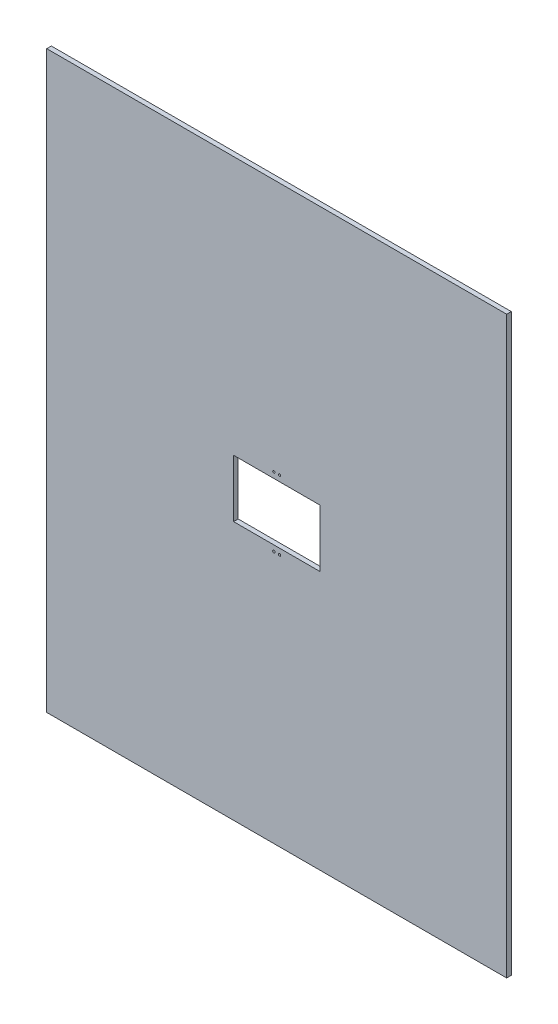
from build123d import *

# Parameters (mm, degrees)
SKETCH1_W           = 800
SKETCH1_H           = 1000
BOSS_EXTRUDE1_DEPTH = 8
SKETCH4_R           = 1.5
CUT_EXTRUDE3_DEPTH  = 10
SKETCH5_W           = 150
SKETCH5_H           = 100
CUT_EXTRUDE4_DEPTH  = 10
SKETCH6_R           = 2
CUT_EXTRUDE5_DEPTH  = 20


with BuildPart() as part:
    # Sketch1 → Boss-Extrude1 (new body)
    with BuildSketch(Plane.XY):
        Rectangle(SKETCH1_W, SKETCH1_H)
    extrude(amount=BOSS_EXTRUDE1_DEPTH)

    # Sketch4 → Cut-Extrude3 (cut)
    with BuildSketch(Plane(origin=(0, 0, 0), x_dir=(-1, 0, 0), z_dir=(0, 0, -1))):
        with Locations((0, 15)):
            Circle(SKETCH4_R)
        with Locations((15, 0)):
            Circle(SKETCH4_R)
        with Locations((0, -15)):
            Circle(SKETCH4_R)
        with Locations((-15, 0)):
            Circle(SKETCH4_R)
    extrude(amount=-CUT_EXTRUDE3_DEPTH, mode=Mode.SUBTRACT)

    # Sketch5 → Cut-Extrude4 (cut)
    with BuildSketch(Plane(origin=(0, 0, 0), x_dir=(-1, 0, 0), z_dir=(0, 0, -1))):
        Rectangle(SKETCH5_W, SKETCH5_H)
    extrude(amount=-CUT_EXTRUDE4_DEPTH, mode=Mode.SUBTRACT)

    # Sketch6 → Cut-Extrude5 (cut)
    with BuildSketch(Plane(origin=(0, 0, 0), x_dir=(-1, 0, 0), z_dir=(0, 0, -1))):
        with Locations((-5, -60)):
            Circle(SKETCH6_R)
        with Locations((5, -60)):
            Circle(SKETCH6_R)
        with Locations((5, 60)):
            Circle(SKETCH6_R)
        with Locations((-5, 60)):
            Circle(SKETCH6_R)
    extrude(amount=-CUT_EXTRUDE5_DEPTH, mode=Mode.SUBTRACT)


solid = part.part
